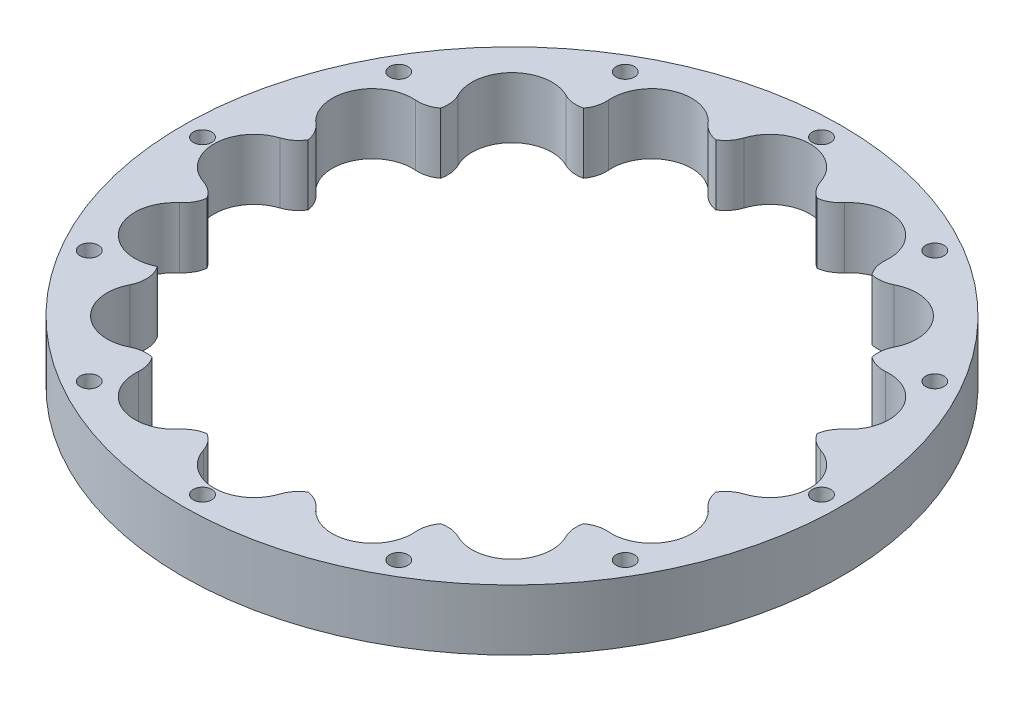
from build123d import *

# Parameters (mm, degrees)
SKETCH1_R           = 57.5
SKETCH1_R_2         = 1.6
BOSS_EXTRUDE1_DEPTH = 10.6
FILLET1_R           = 5


with BuildPart() as part:
    # Sketch1 → Boss-Extrude1 (new body)
    with BuildSketch(Plane(origin=(0, 0, 0), x_dir=(1, 0, 0), z_dir=(0, 1, 0))):
        with Locations(Location((0, 0, 0), (0, 0, 270))):
            Circle(SKETCH1_R)
        with Locations(Location((-27, -46.765371804, 0), (0, 0, 270))):
            Circle(SKETCH1_R_2, mode=Mode.SUBTRACT)
        with Locations(Location((-46.765371804, -27, 0), (0, 0, 270))):
            Circle(SKETCH1_R_2, mode=Mode.SUBTRACT)
        with Locations(Location((-54, 0, 0), (0, 0, 270))):
            Circle(SKETCH1_R_2, mode=Mode.SUBTRACT)
        with Locations(Location((0, -54, 0), (0, 0, 270))):
            Circle(SKETCH1_R_2, mode=Mode.SUBTRACT)
        with Locations(Location((27, -46.765371804, 0), (0, 0, 270))):
            Circle(SKETCH1_R_2, mode=Mode.SUBTRACT)
        with BuildLine():
            ThreePointArc((43.742247125, 10.564838686), (44.135337618, 8.779064491), (44.455555556, 6.978795043))
            ThreePointArc((44.455555556, 6.978795043), (49.753361384, 5.138633627), (52, 0))
            ThreePointArc((52, 0), (49.753361384, -5.138633627), (44.455555556, -6.978795043))
            ThreePointArc((44.455555556, -6.978795043), (44.135337618, -8.779064491), (43.742247125, -10.564838686))
            ThreePointArc((43.742247125, -10.564838686), (47.23910353, -13.108193036), (48.574578963, -17.220754456))
            ThreePointArc((48.574578963, -17.220754456), (45.234108152, -23.187985482), (38.400908644, -23.459970489))
            ThreePointArc((38.400908644, -23.459970489), (37.416132554, -25.000660486), (36.369578094, -26.500071496))
            ThreePointArc((36.369578094, -26.500071496), (38.177808401, -28.89135937), (38.819805153, -31.819805153))
            ThreePointArc((38.819805153, -31.819805153), (34.244868492, -38.386316236), (26.500071496, -36.369578094))
            ThreePointArc((26.500071496, -36.369578094), (25.000660486, -37.416132554), (23.459970489, -38.400908644))
            ThreePointArc((23.459970489, -38.400908644), (24.027901885, -39.942787345), (24.220754456, -41.574578963))
            ThreePointArc((24.220754456, -41.574578963), (18.318158122, -48.488022764), (10.564838686, -43.742247125))
            ThreePointArc((10.564838686, -43.742247125), (8.779064491, -44.135337618), (6.978795043, -44.455555556))
            ThreePointArc((6.978795043, -44.455555556), (6.994696752, -44.727571384), (7, -45))
            ThreePointArc((7, -45), (-0.272428616, -51.994696752), (-6.978795043, -44.455555556))
            ThreePointArc((-6.978795043, -44.455555556), (-8.779064491, -44.135337618), (-10.564838686, -43.742247125))
            ThreePointArc((-10.564838686, -43.742247125), (-19.899538483, -48.041735691), (-23.459970489, -38.400908644))
            ThreePointArc((-23.459970489, -38.400908644), (-25.000660486, -37.416132554), (-26.500071496, -36.369578094))
            ThreePointArc((-26.500071496, -36.369578094), (-36.769552622, -36.769552622), (-36.369578094, -26.500071496))
            ThreePointArc((-36.369578094, -26.500071496), (-37.416132554, -25.000660486), (-38.400908644, -23.459970489))
            ThreePointArc((-38.400908644, -23.459970489), (-48.041735691, -19.899538483), (-43.742247125, -10.564838686))
            ThreePointArc((-43.742247125, -10.564838686), (-44.135337618, -8.779064491), (-44.455555556, -6.978795043))
            ThreePointArc((-44.455555556, -6.978795043), (-52, 0), (-44.455555556, 6.978795043))
            ThreePointArc((-44.455555556, 6.978795043), (-44.135337618, 8.779064491), (-43.742247125, 10.564838686))
            ThreePointArc((-43.742247125, 10.564838686), (-48.041735691, 19.899538483), (-38.400908644, 23.459970489))
            ThreePointArc((-38.400908644, 23.459970489), (-37.416132554, 25.000660486), (-36.369578094, 26.500071496))
            ThreePointArc((-36.369578094, 26.500071496), (-36.769552622, 36.769552622), (-26.500071496, 36.369578094))
            ThreePointArc((-26.500071496, 36.369578094), (-25.000660486, 37.416132554), (-23.459970489, 38.400908644))
            ThreePointArc((-23.459970489, 38.400908644), (-19.899538483, 48.041735691), (-10.564838686, 43.742247125))
            ThreePointArc((-10.564838686, 43.742247125), (-8.779064491, 44.135337618), (-6.978795043, 44.455555556))
            ThreePointArc((-6.978795043, 44.455555556), (-0.272428616, 51.994696752), (7, 45))
            ThreePointArc((7, 45), (6.994696752, 44.727571384), (6.978795043, 44.455555556))
            ThreePointArc((6.978795043, 44.455555556), (8.779064491, 44.135337618), (10.564838686, 43.742247125))
            ThreePointArc((10.564838686, 43.742247125), (18.318158122, 48.488022764), (24.220754456, 41.574578963))
            ThreePointArc((24.220754456, 41.574578963), (24.027901885, 39.942787345), (23.459970489, 38.400908644))
            ThreePointArc((23.459970489, 38.400908644), (25.000660486, 37.416132554), (26.500071496, 36.369578094))
            ThreePointArc((26.500071496, 36.369578094), (34.244868492, 38.386316236), (38.819805153, 31.819805153))
            ThreePointArc((38.819805153, 31.819805153), (38.177808401, 28.89135937), (36.369578094, 26.500071496))
            ThreePointArc((36.369578094, 26.500071496), (37.416132554, 25.000660486), (38.400908644, 23.459970489))
            ThreePointArc((38.400908644, 23.459970489), (45.234108152, 23.187985482), (48.574578963, 17.220754456))
            ThreePointArc((48.574578963, 17.220754456), (47.23910353, 13.108193036), (43.742247125, 10.564838686))
        make_face(mode=Mode.SUBTRACT)
        with Locations(Location((46.765371804, -27, 0), (0, 0, 270))):
            Circle(SKETCH1_R_2, mode=Mode.SUBTRACT)
        with Locations(Location((-46.765371804, 27, 0), (0, 0, 270))):
            Circle(SKETCH1_R_2, mode=Mode.SUBTRACT)
        with Locations(Location((-27, 46.765371804, 0), (0, 0, 270))):
            Circle(SKETCH1_R_2, mode=Mode.SUBTRACT)
        with Locations(Location((54, 0, 0), (0, 0, 270))):
            Circle(SKETCH1_R_2, mode=Mode.SUBTRACT)
        with Locations(Location((46.765371804, 27, 0), (0, 0, 270))):
            Circle(SKETCH1_R_2, mode=Mode.SUBTRACT)
        with Locations(Location((0, 54, 0), (0, 0, 270))):
            Circle(SKETCH1_R_2, mode=Mode.SUBTRACT)
        with Locations(Location((27, 46.765371804, 0), (0, 0, 270))):
            Circle(SKETCH1_R_2, mode=Mode.SUBTRACT)
    extrude(amount=BOSS_EXTRUDE1_DEPTH)

    # Fillet1
    # the kernel refuses this fillet: 5 mm, written as the material it takes off along each edge
    with BuildSketch(Plane(origin=(-23.459970489, -8.409987516, -38.400908644), x_dir=(-0.2723938397119589, 0, -0.9621858428011585), z_dir=(0, 1, 0)), Plane(origin=(-36.369578094, -8.409987516, -26.500071496), x_dir=(-0.6198716741882146, 0, -0.7847031971000881), z_dir=(0, 1, 0)), Plane(origin=(-43.742247125, -8.409987516, -10.564838686), x_dir=(-0.8729796654201095, 0, -0.48775660299271545), z_dir=(0, 1, 0)), Plane(origin=(-44.455555556, -8.409987516, 6.978795043), x_dir=(-0.9931844161721819, 0, -0.11655348760428477), z_dir=(0, 1, 0)), Plane(origin=(-26.500071496, -8.409987516, 36.369578094), x_dir=(-0.7847031971000193, 0, 0.6198716741883018), z_dir=(0, 1, 0)), Plane(origin=(-10.564838686, -8.409987516, 43.742247125), x_dir=(-0.4877566029925422, 0, 0.8729796654202064), z_dir=(0, 1, 0)), Plane(origin=(6.978795043, -8.409987516, 44.455555556), x_dir=(-0.11655348760405627, 0, 0.9931844161722087), z_dir=(0, 1, 0)), Plane(origin=(23.459970489, -8.409987516, 38.400908644), x_dir=(0.2723938397121838, 0, 0.9621858428010948), z_dir=(0, 1, 0)), Plane(origin=(36.369578094, -8.409987516, 26.500071496), x_dir=(0.6198716741885055, 0, 0.7847031970998585), z_dir=(0, 1, 0)), Plane(origin=(43.742247125, -8.409987516, 10.564838686), x_dir=(0.8729796654202305, 0, 0.48775660299249896), z_dir=(0, 1, 0)), Plane(origin=(44.455555556, -8.409987516, -6.978795043), x_dir=(0.993184416172219, 0, 0.11655348760396912), z_dir=(0, 1, 0)), Plane(origin=(38.400908644, -8.409987516, -23.459970489), x_dir=(0.9621858428010855, 0, -0.2723938397122163), z_dir=(0, 1, 0)), Plane(origin=(26.500071496, -8.409987516, -36.369578094), x_dir=(0.7847031970998928, 0, -0.6198716741884621), z_dir=(0, 1, 0)), Plane(origin=(10.564838686, -8.409987516, -43.742247125), x_dir=(0.4877566029926196, 0, -0.8729796654201631), z_dir=(0, 1, 0)), Plane(origin=(-6.978795043, -8.409987516, -44.455555556), x_dir=(0.11655348760419053, 0, -0.9931844161721929), z_dir=(0, 1, 0))) as fillet1_piece_1:
        with BuildLine():
            CenterArc((3.675513735, 4.905552558), FILLET1_R, 199.899092777, 58.946827573)
            ThreePointArc((-1.025953847, 3.20372925), (-0.483029435, 1.61145493), (0, 0))
            ThreePointArc((0, 0), (1.354136639, 0.132226419), (2.708273278, 0))
        make_face()
    extrude(amount=27.419975032, mode=Mode.SUBTRACT)
    with BuildSketch(Plane(origin=(-26.500071496, -8.409987516, -36.369578094), x_dir=(0.8296594592290296, 0, -0.5582698108547461), z_dir=(0, 1, 0)), Plane(origin=(-38.400908644, -8.409987516, -23.459970489), x_dir=(0.5528647859323804, 0, -0.8332709814195759), z_dir=(0, 1, 0)), Plane(origin=(-44.455555556, -8.409987516, -6.978795043), x_dir=(0.1919014607092957, 0, -0.9814141986835317), z_dir=(0, 1, 0)), Plane(origin=(-43.742247125, -8.409987516, 10.564838686), x_dir=(-0.19827712231571695, 0, -0.9801460007397867), z_dir=(0, 1, 0)), Plane(origin=(-36.369578094, -8.409987516, 26.500071496), x_dir=(-0.558269810854761, 0, -0.8296594592290196), z_dir=(0, 1, 0)), Plane(origin=(-23.459970489, -8.409987516, 38.400908644), x_dir=(-0.8332709814195962, 0, -0.5528647859323499), z_dir=(0, 1, 0)), Plane(origin=(-6.978795043, -8.409987516, 44.455555556), x_dir=(-0.9814141986835541, 0, -0.19190146070918135), z_dir=(0, 1, 0)), Plane(origin=(10.564838686, -8.409987516, 43.742247125), x_dir=(-0.9801460007397754, 0, 0.1982771223157732), z_dir=(0, 1, 0)), Plane(origin=(26.500071496, -8.409987516, 36.369578094), x_dir=(-0.8296594592289986, 0, 0.5582698108547921), z_dir=(0, 1, 0)), Plane(origin=(38.400908644, -8.409987516, 23.459970489), x_dir=(-0.552864785932314, 0, 0.83327098141962), z_dir=(0, 1, 0)), Plane(origin=(44.455555556, -8.409987516, 6.978795043), x_dir=(-0.19190146070922567, 0, 0.9814141986835454), z_dir=(0, 1, 0)), Plane(origin=(43.742247125, -8.409987516, -10.564838686), x_dir=(0.19827712231576203, 0, 0.9801460007397778), z_dir=(0, 1, 0)), Plane(origin=(23.459970489, -8.409987516, -38.400908644), x_dir=(0.8332709814195809, 0, 0.552864785932373), z_dir=(0, 1, 0)), Plane(origin=(6.978795043, -8.409987516, -44.455555556), x_dir=(0.9814141986835359, 0, 0.19190146070927452), z_dir=(0, 1, 0)), Plane(origin=(-10.564838686, -8.409987516, -43.742247125), x_dir=(0.9801460007397866, 0, -0.1982771223157175), z_dir=(0, 1, 0))) as fillet1_piece_2:
        with BuildLine():
            CenterArc((3.550883618, 4.996506044), FILLET1_R, 208.911087711, 58.946827573)
            ThreePointArc((-0.825971318, 2.579247086), (-0.287058705, 1.329950061), (0, 0))
            ThreePointArc((0, 0), (1.681997503, 0.031445605), (3.363995006, 0))
        make_face()
    extrude(amount=27.419975032, mode=Mode.SUBTRACT)
    with BuildSketch(Plane(origin=(36.369578094, -8.409987516, -26.500071496), x_dir=(0.6198716741884495, 0, -0.7847031970999027), z_dir=(0, 1, 0))) as fillet1_piece_3:
        with BuildLine():
            CenterArc((3.675513735, -4.905552558), FILLET1_R, 101.154079649, 58.946827573)
            ThreePointArc((-1.025953847, -3.20372925), (-0.483029435, -1.61145493), (0, 0))
            ThreePointArc((0, 0), (1.354136639, -0.132226419), (2.708273278, 0))
        make_face()
    extrude(amount=27.419975032, mode=Mode.SUBTRACT)


solid = part.part
